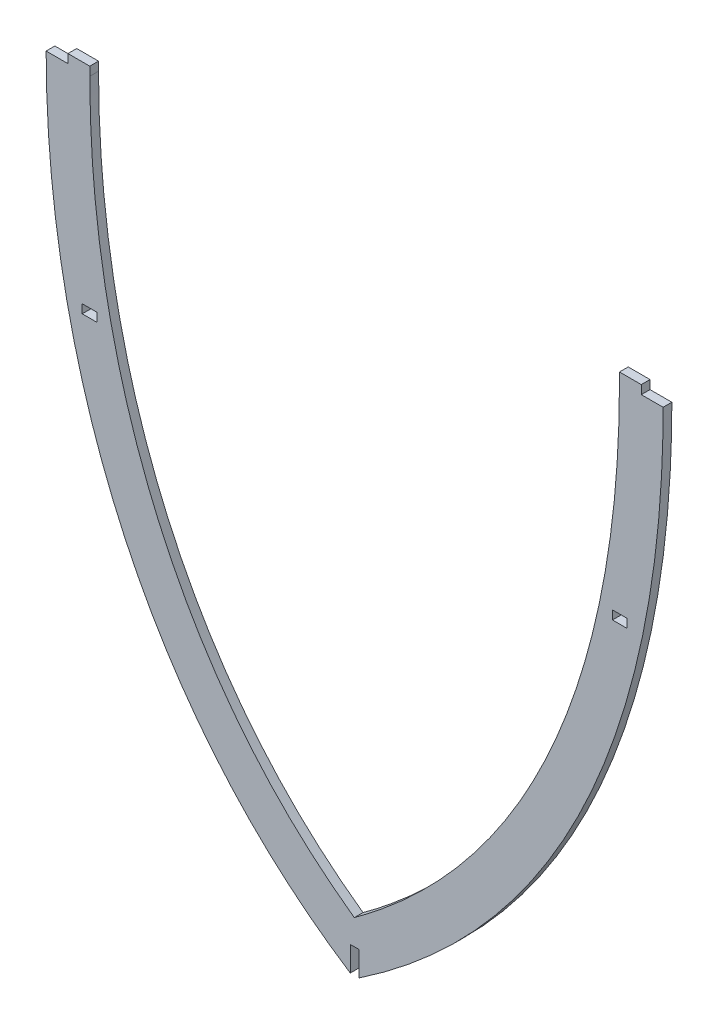
from build123d import *

# Parameters (mm, degrees)
SKETCH1_W           = 5
SKETCH1_H           = 3
BOSS_EXTRUDE1_DEPTH = 1.5
SKETCH2_W           = 3
SKETCH2_H           = 9.494035225
CUT_EXTRUDE1_DEPTH  = 3


with BuildPart() as part:
    # Sketch1 → Boss-Extrude1 (new, symmetric)
    with BuildSketch(Plane.XY):
        with BuildLine():
            Line((-106.000000057, -83), (-98.500000057, -83))
            Line((-98.500000057, -83), (-98.500000057, -80))
            Line((-98.500000057, -80), (-91.000000057, -80))
            Line((-91.000000057, -80), (-91.000000057, -83))
            add(Edge.make_bspline(
                [(-91.000000057, -83), (-91.000000057, -88.068550708), (-90.784225032, -98.22048114), (-89.471687984, -118.377767109), (-86.146815185, -143.230800075), (-79.368059281, -172.071120673), (-69.717388827, -199.531988631), (-57.11831244, -225.231718481), (-44.09611352, -244.888891262), (-32.112008871, -259.401886593), (-22.324804418, -269.642683257), (-13.481107718, -277.613388833), (-5.992695333, -283.625797935), (-2.089373244, -286.52106573), (-0.116739652, -287.926353361)],
                knots=[0, 0, 0, 0, 0.059983469, 0.119966937, 0.239933875, 0.359900812, 0.47986775, 0.599834687, 0.719801625, 0.779785093, 0.839768562, 0.899752031, 0.929743765, 0.9597355, 0.9597355, 0.9597355, 0.9597355], degree=3))
            add(Edge.make_bspline(
                [(-0.116739652, -287.926353361), (1.870810307, -286.480217153), (5.811438814, -283.506382099), (13.355962691, -277.384642593), (22.257609371, -269.345287052), (32.090104571, -259.121737971), (44.109675814, -244.741072802), (57.139620078, -225.411627335), (69.72515405, -200.20455834), (79.363006379, -173.160517067), (85.009288887, -149.261906767), (88.135960752, -129.439309115), (89.79642617, -114.252560897), (90.618872636, -101.350995086), (90.945843491, -90.910045135), (90.999999943, -85.63202658), (90.999999943, -83)],
                knots=[0, 0, 0, 0, 0.030008035, 0.060016069, 0.120032138, 0.180048207, 0.240064276, 0.360096415, 0.480128553, 0.600160691, 0.720192829, 0.780208898, 0.840224967, 0.900241036, 0.930249071, 0.960257105, 0.960257105, 0.960257105, 0.960257105], degree=3))
            Line((90.999999943, -83), (90.999999943, -80))
            Line((90.999999943, -80), (98.499999943, -80))
            Line((98.499999943, -80), (98.499999943, -83))
            Line((98.499999943, -83), (105.999999943, -83))
            add(Edge.make_bspline(
                [(105.999999943, -83), (105.999999943, -174.443319162), (74.76294096, -256.782973392), (0, -306.089272366)],
                knots=[0, 0, 0, 0, 1, 1, 1, 1], degree=3))
            add(Edge.make_bspline(
                [(-106.000000057, -83), (-106.000000057, -171.171702982), (-74.762940905, -258.439172245), (0, -306.089272366)],
                knots=[0, 0, 0, 0, 1, 1, 1, 1], degree=3))
        make_face()
        with Locations((-91.1, -153.5)):
            Rectangle(SKETCH1_W, SKETCH1_H, mode=Mode.SUBTRACT)
        with Locations((91.1, -153.5)):
            Rectangle(SKETCH1_W, SKETCH1_H, mode=Mode.SUBTRACT)
    extrude(amount=BOSS_EXTRUDE1_DEPTH, both=True)

    # Sketch2 → Cut-Extrude1 (cut)
    with BuildSketch(Plane.XY.offset(1.5)):
        with Locations((0, -301.342254754)):
            Rectangle(SKETCH2_W, SKETCH2_H)
    extrude(amount=-CUT_EXTRUDE1_DEPTH, mode=Mode.SUBTRACT)


solid = part.part
